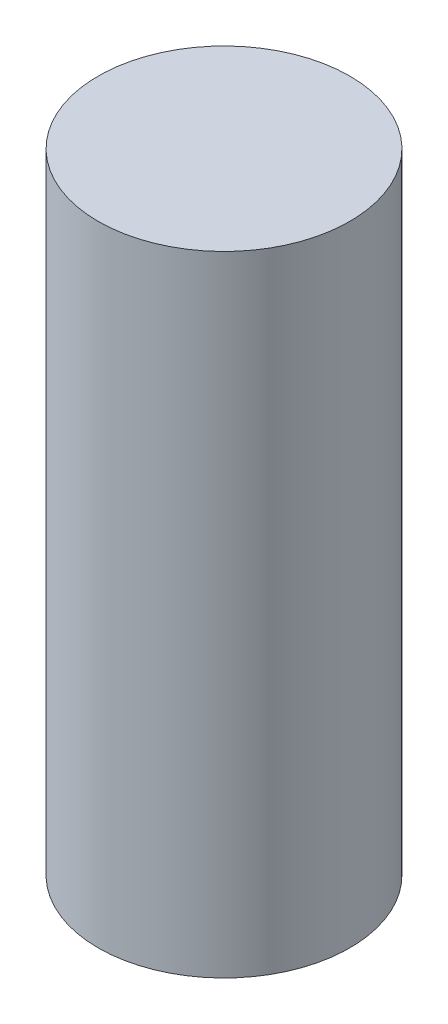
from build123d import *

# Parameters (mm, degrees)
SKETCH2_R           = 20
BOSS_EXTRUDE1_DEPTH = 100


with BuildPart() as part:
    # Sketch2 → Boss-Extrude1 (new body)
    with BuildSketch(Plane(origin=(0, 0, 0), x_dir=(1, 0, 0), z_dir=(0, 1, 0))):
        Circle(SKETCH2_R)
    extrude(amount=BOSS_EXTRUDE1_DEPTH)


solid = part.part
